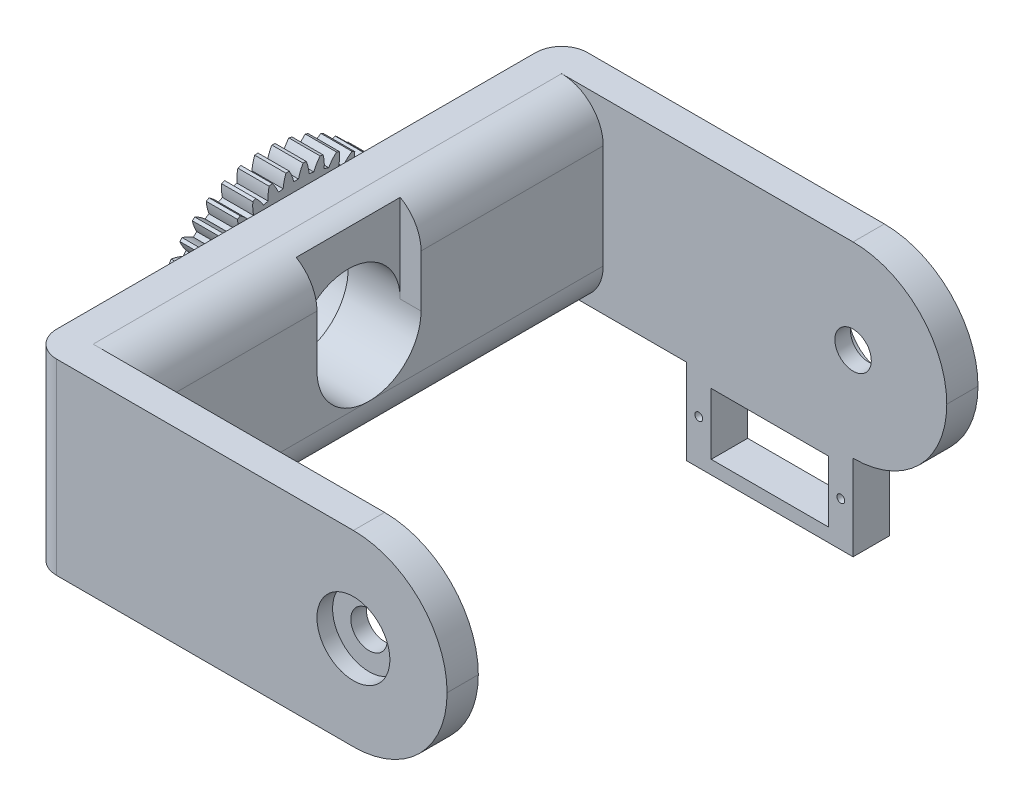
from build123d import *

# Parameters (mm, degrees)
BASPROSKE_W              = 6
BASPROSKE_H              = 22
TOOTHCUT_DEPTH           = 32.685959036
TEETHCUTS_COUNT          = 42
TEETHCUTS_ANGLE          = 351.428571429
BORSKE_R                 = 0.4
BORE_DEPTH               = 50.0000508
SKETCH1_R                = 12.15
CUT_EXTRUDE1_DEPTH       = 32.657846798
SKETCH2_W                = 102
SKETCH2_H                = 36
BOSS_EXTRUDE1_DEPTH      = 10
SKETCH3_W                = 6
SKETCH3_H                = 36
BOSS_EXTRUDE2_DEPTH      = 70
FILLET1_R                = 18
FILLET2_R                = 5
CUT_EXTRUDE2_DEPTH       = 136.211757121
CUT_EXTRUDE2_DEPTH_BACK  = 136.211757121
SKETCH4_R                = 3.5
CUT_EXTRUDE3_DEPTH       = 136.211757121
CUT_EXTRUDE3_DEPTH_BACK  = 3
SKETCH5_R                = 7
CUT_EXTRUDE4_START       = -3
SKETCH6_R                = 7
CUT_EXTRUDE4_DEPTH       = 3
SKETCH7_R                = 10
CUT_EXTRUDE5_DEPTH       = 98.38182204
BOSS_EXTRUDE3_DEPTH      = 4
FILLET3_R                = 8
BOSS_EXTRUDE4_DEPTH      = 1
BOSS_EXTRUDE4_DEPTH_BACK = 6
SKETCH9_W                = 32
SKETCH9_H                = 17
CUT_EXTRUDE6_REACH       = 140.521
SKETCH10_R               = 0.75
SKETCH10_W               = 22.5
SKETCH10_H               = 11.8


# Some blends are built 0.0001 mm under size
with BuildPart() as part:
    # BasProSke → Base-Revolve (revolve)
    with BuildSketch(Plane(origin=(0, 0, 0), x_dir=(1, 0, 0), z_dir=(0, 1, 0)), mode=Mode.PRIVATE) as base_revolve_sk:
        with Locations((3, 11)):
            Rectangle(BASPROSKE_W, BASPROSKE_H)
    revolve(base_revolve_sk.sketch.rotate(Axis((-10, 0, 0), (1, 0, 0)), 180), axis=Axis((-10, 0, 0), (1, 0, 0)))

    # TooCutSke → ToothCut (cut, through all)
    with BuildSketch(Plane(origin=(0, 0, 0), x_dir=(0, 0, -1), z_dir=(1, 0, 0))):
        with BuildLine():
            ThreePointArc((0.446078735, 19.743961476), (0, 19.749), (-0.446078735, 19.743961476))
            ThreePointArc((-0.446078735, 19.743961476), (-0.816459964, 20.896623713), (-1.348697399, 21.984068333))
            ThreePointArc((-1.348697399, 21.984068333), (0, 22.0254), (1.348697399, 21.984068333))
            ThreePointArc((1.348697399, 21.984068333), (0.816459964, 20.896623713), (0.446078735, 19.743961476))
        make_face()
    toothcut = extrude(amount=TOOTHCUT_DEPTH, mode=Mode.SUBTRACT)

    # TeethCuts: ToothCut ×42 about axis
    teethcuts_axis = Axis((-10, 0, 0), (1, 0, 0))
    for i in range(1, TEETHCUTS_COUNT):
        add(toothcut.rotate(teethcuts_axis, i * TEETHCUTS_ANGLE / (TEETHCUTS_COUNT - 1)), mode=Mode.SUBTRACT)

    # BorSke → Bore (cut, symmetric)
    with BuildSketch(Plane(origin=(0, 0, 0), x_dir=(0, 0, -1), z_dir=(1, 0, 0))):
        with Locations(Location((0, 0, 0), (0, 0, 180))):
            Circle(BORSKE_R)
    extrude(amount=BORE_DEPTH, both=True, mode=Mode.SUBTRACT)

    # Sketch1 → Cut-Extrude1 (cut, through all)
    with BuildSketch(Plane(origin=(6, 0, 0), x_dir=(0, 0, -1), z_dir=(1, 0, 0))):
        Circle(SKETCH1_R)
    extrude(amount=-CUT_EXTRUDE1_DEPTH, mode=Mode.SUBTRACT)

    # Sketch2 → Boss-Extrude1 (add)
    with BuildSketch(Plane(origin=(6, 0, 0), x_dir=(0, 0, -1), z_dir=(1, 0, 0))):
        Rectangle(SKETCH2_W, SKETCH2_H)
    extrude(amount=BOSS_EXTRUDE1_DEPTH)

    # Sketch3 → Boss-Extrude2 (add)
    with BuildSketch(Plane(origin=(16, 0, 0), x_dir=(0, 0, -1), z_dir=(1, 0, 0))):
        with Locations((-48, 0)):
            Rectangle(SKETCH3_W, SKETCH3_H)
        with Locations((48, 0)):
            Rectangle(SKETCH3_W, SKETCH3_H)
    extrude(amount=BOSS_EXTRUDE2_DEPTH)

    # Fillet1
    fillet1_edges = [part.edges().sort_by_distance(p)[0] for p in [
        (86, -18, -48),
        (86, 18, -48),
        (86, 18, 48),
        (86, -18, 48),
    ]]
    fillet(fillet1_edges, radius=FILLET1_R - 0.0001)  # a hair under: the kernel refuses the full size

    # Fillet2
    fillet2_edges = [part.edges().sort_by_distance(p)[0] for p in [
        (6, 0, -51),
        (6, 0, 51),
    ]]
    fillet(fillet2_edges, radius=FILLET2_R)

    # Sketch4 → Cut-Extrude2 (cut, two sides: drawn at the far end of the back side and taken through both)
    with BuildSketch(Plane.XY.offset(51).offset(-CUT_EXTRUDE2_DEPTH_BACK)):
        with Locations(Location((68, 0, 0), (0, 0, 270))):
            Circle(SKETCH4_R)
    extrude(amount=CUT_EXTRUDE2_DEPTH + CUT_EXTRUDE2_DEPTH_BACK, mode=Mode.SUBTRACT)

    # Sketch5 → Cut-Extrude3 (cut, two sides: drawn at the far end of the back side and taken through both)
    with BuildSketch(Plane.XY.offset(51).offset(-CUT_EXTRUDE3_DEPTH_BACK)):
        with Locations(Location((68, 0, 0), (0, 0, 180))):
            Circle(SKETCH5_R)
    extrude(amount=CUT_EXTRUDE3_DEPTH + CUT_EXTRUDE3_DEPTH_BACK, mode=Mode.SUBTRACT)

    # Sketch6 → Cut-Extrude4 (cut)
    with BuildSketch(Plane(origin=(0, 0, -51), x_dir=(-1, 0, 0), z_dir=(0, 0, -1)).offset(CUT_EXTRUDE4_START)):
        with Locations((-68, 0)):
            Circle(SKETCH6_R)
    extrude(amount=CUT_EXTRUDE4_DEPTH, mode=Mode.SUBTRACT)

    # Sketch7 → Cut-Extrude5 (cut, through all)
    with BuildSketch(Plane.ZY.offset(-6)):
        Circle(SKETCH7_R)
    extrude(amount=-CUT_EXTRUDE5_DEPTH, mode=Mode.SUBTRACT)

    # Sketch8 → Boss-Extrude3 (add)
    with BuildSketch(Plane(origin=(16, 0, 0), x_dir=(0, 0, -1), z_dir=(1, 0, 0))):
        with BuildLine():
            Line((-45, 18), (-45, -18))
            Line((-45, -18), (45, -18))
            Line((45, -18), (45, 18))
            Line((45, 18), (10, 18))
            Line((10, 18), (10, 0))
            ThreePointArc((10, 0), (0, -10), (-10, 0))
            Line((-10, 0), (-10, 18))
            Line((-10, 18), (-45, 18))
        make_face()
    extrude(amount=BOSS_EXTRUDE3_DEPTH)

    # Fillet3
    # the kernel refuses this fillet: 8 mm, written as the material it takes off along each edge
    with BuildSketch(Plane(origin=(20, 18, -10), x_dir=(-1, 0, 0), z_dir=(0, 0, 1)), Plane(origin=(20, 18, -45), x_dir=(-1, 0, 0), z_dir=(0, 0, 1))) as fillet3_piece_1:
        with BuildLine():
            CenterArc((FILLET3_R, FILLET3_R), FILLET3_R, 180, 90)
            Line((0, FILLET3_R), (0, 0))
            Line((0, 0), (FILLET3_R, 0))
        make_face()
    extrude(amount=55, mode=Mode.SUBTRACT)
    with BuildSketch(Plane(origin=(20, -18, 45), x_dir=(-1, 0, 0), z_dir=(0, 0, -1))) as fillet3_piece_2:
        with BuildLine():
            CenterArc((FILLET3_R, FILLET3_R), FILLET3_R, 180, 90)
            Line((0, FILLET3_R), (0, 0))
            Line((0, 0), (FILLET3_R, 0))
        make_face()
    extrude(amount=90, mode=Mode.SUBTRACT)

    # Sketch9 → Boss-Extrude4 (add, two sides: drawn at the far end of the back side and taken through both)
    with BuildSketch(Plane(origin=(0, 0, -51), x_dir=(-1, 0, 0), z_dir=(0, 0, -1)).offset(-BOSS_EXTRUDE4_DEPTH_BACK)):
        with Locations((-52, -25.895511194)):
            Rectangle(SKETCH9_W, SKETCH9_H)
    extrude(amount=BOSS_EXTRUDE4_DEPTH + BOSS_EXTRUDE4_DEPTH_BACK)

    # Sketch10 → Cut-Extrude6 (cut, up to next)
    with BuildSketch(Plane(origin=(0, 0, -52), x_dir=(-1, 0, 0), z_dir=(0, 0, -1)), mode=Mode.PRIVATE) as cut_extrude6_sk1:
        with Locations((-65.65, -25.895511194)):
            Circle(SKETCH10_R)
    cut_extrude6_tool1 = extrude(cut_extrude6_sk1.sketch, amount=-CUT_EXTRUDE6_REACH, mode=Mode.PRIVATE) & part.part
    # Sketch10 → Cut-Extrude6 (cut, up to next)
    with BuildSketch(Plane(origin=(0, 0, -52), x_dir=(-1, 0, 0), z_dir=(0, 0, -1)), mode=Mode.PRIVATE) as cut_extrude6_sk2:
        with Locations((-38.35, -25.895511194)):
            Circle(SKETCH10_R)
    cut_extrude6_tool2 = extrude(cut_extrude6_sk2.sketch, amount=-CUT_EXTRUDE6_REACH, mode=Mode.PRIVATE) & part.part
    # Sketch10 → Cut-Extrude6 (cut, up to next)
    with BuildSketch(Plane(origin=(0, 0, -52), x_dir=(-1, 0, 0), z_dir=(0, 0, -1)), mode=Mode.PRIVATE) as cut_extrude6_sk3:
        with Locations((-52, -25.895511194)):
            Rectangle(SKETCH10_W, SKETCH10_H)
    cut_extrude6_tool3 = extrude(cut_extrude6_sk3.sketch, amount=-CUT_EXTRUDE6_REACH, mode=Mode.PRIVATE) & part.part
    add(cut_extrude6_tool1.solids().sort_by_distance((65.65, -25.895511, -52))[0], mode=Mode.SUBTRACT)
    add(cut_extrude6_tool2.solids().sort_by_distance((38.35, -25.895511, -52))[0], mode=Mode.SUBTRACT)
    add(cut_extrude6_tool3.solids().sort_by_distance((52, -25.895511, -52))[0], mode=Mode.SUBTRACT)


solid = part.part
